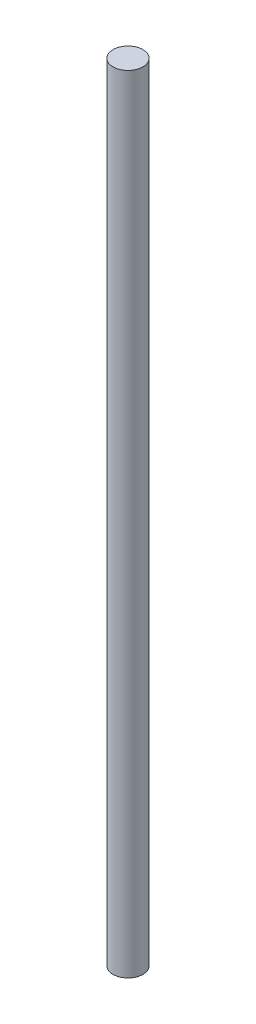
from build123d import *

# Parameters (mm, degrees)
SKETCH1_R           = 4
BOSS_EXTRUDE1_DEPTH = 210


with BuildPart() as part:
    # Sketch1 → Boss-Extrude1 (new body)
    with BuildSketch(Plane(origin=(0, 0, 0), x_dir=(1, 0, 0), z_dir=(0, 1, 0))):
        Circle(SKETCH1_R)
    extrude(amount=BOSS_EXTRUDE1_DEPTH)


solid = part.part
